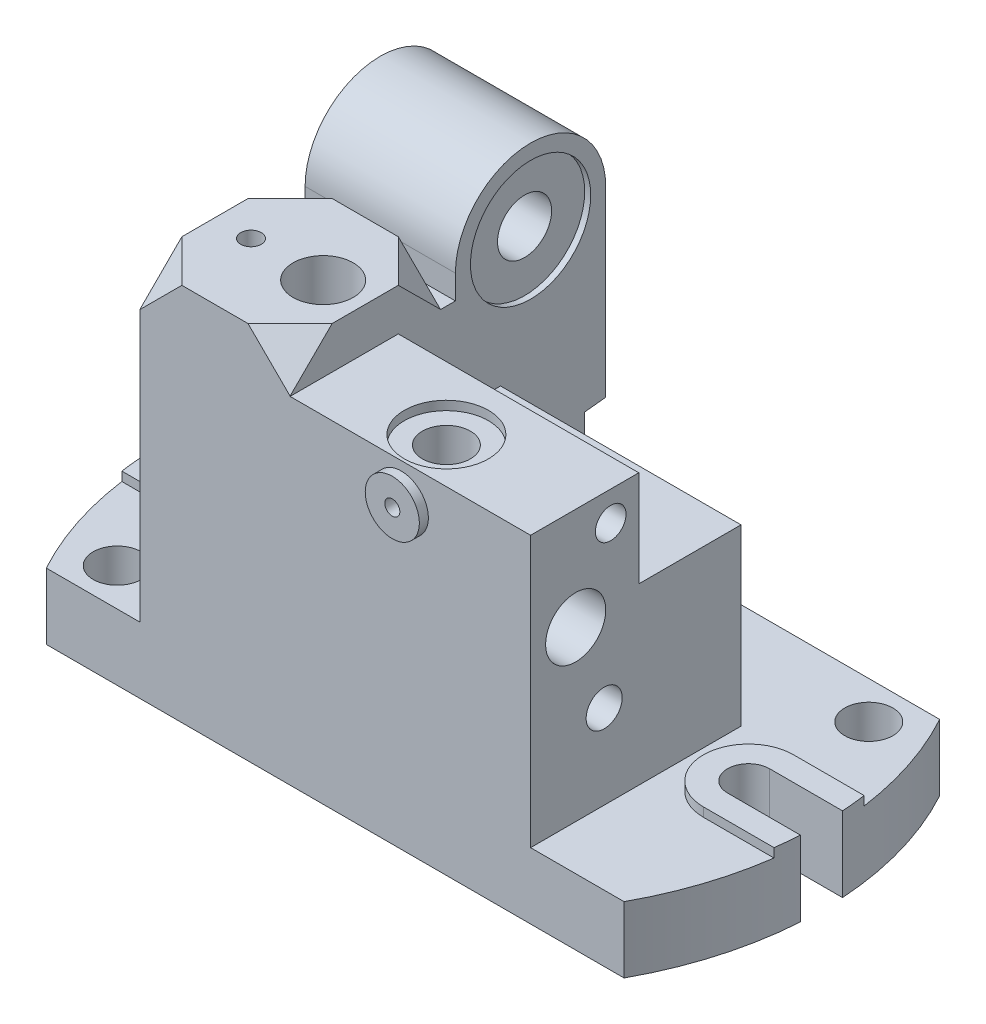
from build123d import *

# Parameters (mm, degrees)
EXTRUDE_1_DEPTH          = 22
SKETCH_2_W               = 130
SKETCH_2_H               = 70
EXTRUDE_2_DEPTH          = 90
CUT_EXTRUDE_2_REACH      = 167.198
SKETCH_4_R               = 8
EXTRUDE_3_DEPTH          = 50
SKETCH_6_W               = 50
SKETCH_6_H               = 50
EXTRUDE_4_DEPTH          = 14
CHAMFER_START            = -142
CHAMFER_1_OUTLINE_W      = 20
CHAMFER_1_OUTLINE_H      = 22
CHAMFER_1_DEPTH          = 9.498113221
CHAMFER_START_2          = 86.62897838
CHAMFER_2_DEPTH          = 9.37102162
CHAMFER_START_3          = -134.90192828
CHAMFER_3_DEPTH          = 45.34578231
CHAMFER_START_4          = 32.785213501
CHAMFER_4_DEPTH          = 35.552289575
SKETCH_8_W               = 80
SKETCH_8_H               = 34
CUT_EXTRUDE_3_DEPTH      = 32
SKETCH_9_R               = 20
CUT_EXTRUDE_4_DEPTH      = 2
SKETCH_10_R              = 9
CUT_EXTRUDE_5_DEPTH      = 48
CUT_EXTRUDE_6_DEPTH      = 50
HOLE_WIZARD_M24_2_D      = 21
HOLE_WIZARD_M24_2_DEPTH  = 17
CHAMFER_5_SIZE           = 1
SKETCH_17_R              = 10
CUT_EXTRUDE_7_DEPTH      = 113
SKETCH_18_R              = 14
CUT_EXTRUDE_8_DEPTH      = 3
CUT_EXTRUDE_9_REACH      = 165.179
CUT_EXTRUDE_9_END_RADIUS = 10
SKETCH_19_R              = 8
EXTRUDE_5_DEPTH          = 25
CUT_EXTRUDE_10_REACH     = 172.723
SKETCH_3_W               = 96
SKETCH_3_H               = 46
CUT_EXTRUDE_1_DEPTH      = 60
SKETCH_22_R              = 12.5
EXTRUDE_6_DEPTH          = 4
HOLE_WIZARD_M8_1_D       = 6.8
HOLE_WIZARD_M8_1_DEPTH   = 20
HOLE_WIZARD_M8_1_TIP     = 2.042926105
SKETCH_24_R              = 9
EXTRUDE_7_DEPTH          = 3
SKETCH_28_R              = 10
CUT_EXTRUDE_11_DEPTH     = 35
HOLE_WIZARD_M6_1_REACH   = 199.224
HOLE_WIZARD_M6_1_BORE_R  = 2.5
CUT_EXTRUDE_12_REACH     = 197.692
SKETCH_39_R              = 6
SKETCH_40_R              = 7
CUT_EXTRUDE_13_DEPTH     = 4
HOLE_WIZARD_M5_1_D       = 4.2
HOLE_WIZARD_M5_1_DEPTH   = 14
HOLE_WIZARD_M5_1_TIP     = 1.2618073
CUT_EXTRUDE_14_REACH     = 235.404
SKETCH_44_R              = 6


with BuildPart() as part:
    # 草图1 → 凸台-拉伸1 (new body)
    with BuildSketch(Plane(origin=(0, 0, 0), x_dir=(1, 0, 0), z_dir=(0, 1, 0))):
        with BuildLine():
            Line((-96.093704268, 52.5), (96.093704268, 52.5))
            ThreePointArc((96.093704268, 52.5), (109.5, 0), (96.093704268, -52.5))
            Line((96.093704268, -52.5), (-96.093704268, -52.5))
            ThreePointArc((-96.093704268, -52.5), (-109.5, 0), (-96.093704268, 52.5))
        make_face()
    extrude(amount=EXTRUDE_1_DEPTH)

    # 草图2 → 凸台-拉伸2 (add)
    with BuildSketch(Plane(origin=(0, 22, 0), x_dir=(1, 0, 0), z_dir=(0, 1, 0))):
        with Locations((0, -17.5)):
            Rectangle(SKETCH_2_W, SKETCH_2_H)
    extrude(amount=EXTRUDE_2_DEPTH)

    # 草图4 → 切除-拉伸2 (cut, up to next)
    with BuildSketch(Plane.XZ, mode=Mode.PRIVATE) as cut_extrude_2_sk1:
        with Locations(Location((85, -40, 0), (0, 0, 270))):
            Circle(SKETCH_4_R)
    cut_extrude_2_tool1 = extrude(cut_extrude_2_sk1.sketch, amount=-CUT_EXTRUDE_2_REACH, mode=Mode.PRIVATE) & part.part
    # 草图4 → 切除-拉伸2 (cut, up to next)
    with BuildSketch(Plane.XZ, mode=Mode.PRIVATE) as cut_extrude_2_sk2:
        with Locations(Location((-85, 40, 0), (0, 0, 270))):
            Circle(SKETCH_4_R)
    cut_extrude_2_tool2 = extrude(cut_extrude_2_sk2.sketch, amount=-CUT_EXTRUDE_2_REACH, mode=Mode.PRIVATE) & part.part
    add(cut_extrude_2_tool1.solids().sort_by_distance((85, 0, -40))[0], mode=Mode.SUBTRACT)
    add(cut_extrude_2_tool2.solids().sort_by_distance((-85, 0, 40))[0], mode=Mode.SUBTRACT)

    # 草图5 → 凸台-拉伸3 (add)
    with BuildSketch(Plane.ZY.offset(65)):
        with BuildLine():
            Line((52.5, 22), (-52.5, 22))
            Line((-52.5, 22), (-52.5, 120))
            ThreePointArc((-52.5, 120), (-27.5, 145), (-2.5, 120))
            Line((-2.5, 120), (-2.5, 112))
            Line((-2.5, 112), (52.5, 112))
            Line((52.5, 112), (52.5, 22))
        make_face()
    extrude(amount=-EXTRUDE_3_DEPTH)

    # 草图6 → 凸台-拉伸4 (add)
    with BuildSketch(Plane(origin=(0, 112, 0), x_dir=(1, 0, 0), z_dir=(0, 1, 0))):
        with Locations((-40, -27.5)):
            Rectangle(SKETCH_6_W, SKETCH_6_H)
    extrude(amount=EXTRUDE_4_DEPTH)

    # 倒角1: read off the stored shape, not the designer's step
    # 倒角1 outline → 倒角1 (cut)
    with BuildSketch(Plane(origin=(0, 0, 0), x_dir=(0.8164965809277258, 0.40824829046386313, 0.40824829046386313), z_dir=(0.5773502691896258, -0.5773502691896258, -0.5773502691896258)).offset(CHAMFER_START)):
        with Locations((23, -52)):
            Rectangle(CHAMFER_1_OUTLINE_W, CHAMFER_1_OUTLINE_H)
    extrude(amount=CHAMFER_1_DEPTH, mode=Mode.SUBTRACT)

    # 倒角2: read off the stored shape, not the designer's step
    # 倒角2 outline → 倒角2 (cut)
    with BuildSketch(Plane(origin=(0, 0, 0), x_dir=(0.8174738237346374, -0.40872641016099387, -0.40580693580270144), z_dir=(0.5759657520275584, 0.5801093905313534, 0.5759657520275585)).offset(CHAMFER_START_2)):
        Polygon((-79.385202065, 41.726128481), (-79.385202065, 61.454534398), (-96.511132698, 51.519621216), align=None)
    extrude(amount=CHAMFER_2_DEPTH, mode=Mode.SUBTRACT)

    # 倒角3: read off the stored shape, not the designer's step
    # 倒角3 outline → 倒角3 (cut)
    with BuildSketch(Plane(origin=(0, 0, 0), x_dir=(0.7045678226077661, 0.7096366558639369, 0), z_dir=(0.7096366558639368, -0.7045678226077663, 0)).offset(CHAMFER_START_3)):
        Polygon((78.8457013, 16.5), (68.981751783, 2.5), (80, 2.5), (80, 18), (79.902553034, 18), align=None)
    extrude(amount=CHAMFER_3_DEPTH, mode=Mode.SUBTRACT)

    # 倒角4: read off the stored shape, not the designer's step
    # 倒角4 outline → 倒角4 (cut)
    with BuildSketch(Plane(origin=(0, 0, 0), x_dir=(0.7045678226077663, -0.7096366558639366, 0), z_dir=(0.7096366558639366, 0.7045678226077662, 0)).offset(CHAMFER_START_4)):
        Polygon((-135.211127108, -16.5), (-125.347177592, -2.5), (-137, -2.5), (-137, -18), (-136.267978842, -18), align=None)
    extrude(amount=CHAMFER_4_DEPTH, mode=Mode.SUBTRACT)

    # 草图8 → 切除-拉伸3 (cut)
    with BuildSketch(Plane(origin=(0, 112, 0), x_dir=(1, 0, 0), z_dir=(0, 1, 0))):
        with Locations((25, 0.5)):
            Rectangle(SKETCH_8_W, SKETCH_8_H)
    extrude(amount=-CUT_EXTRUDE_3_DEPTH, mode=Mode.SUBTRACT)

    # 草图9 → 切除-拉伸4 (cut)
    with BuildSketch(Plane(origin=(-15, 0, 0), x_dir=(0, 0, -1), z_dir=(1, 0, 0))):
        with Locations((27.5, 120)):
            Circle(SKETCH_9_R)
    extrude(amount=-CUT_EXTRUDE_4_DEPTH, mode=Mode.SUBTRACT)

    # 草图10 → 切除-拉伸5 (cut)
    with BuildSketch(Plane(origin=(-17, 0, 0), x_dir=(0, 0, -1), z_dir=(1, 0, 0))):
        with Locations((27.5, 120)):
            Circle(SKETCH_10_R)
    extrude(amount=-CUT_EXTRUDE_5_DEPTH, mode=Mode.SUBTRACT)

    # 草图11 → 切除-拉伸6 (cut)
    with BuildSketch(Plane.ZY.offset(65)):
        Polygon((-52.5, 40.75), (-52.5, 59.25), (-45.5, 58.5), (-45.5, 41.5), align=None)
    extrude(amount=-CUT_EXTRUDE_6_DEPTH, mode=Mode.SUBTRACT)

    # M24 螺纹孔2
    with Locations(Plane.ZY.offset(65)):
        with Locations((37.5, 78)):
            Hole(HOLE_WIZARD_M24_2_D / 2, depth=HOLE_WIZARD_M24_2_DEPTH)

    # 倒角5
    chamfer_5_edges = [part.edges().sort_by_distance(p)[0] for p in [
        (-48, 78, 48),
    ]]
    chamfer(chamfer_5_edges, length=CHAMFER_5_SIZE)

    # 草图17 → 切除-拉伸7 (cut)
    with BuildSketch(Plane.ZY.offset(48)):
        with Locations((37.5, 78)):
            Circle(SKETCH_17_R)
    extrude(amount=-CUT_EXTRUDE_7_DEPTH, mode=Mode.SUBTRACT)

    # 草图18 → 切除-拉伸8 (cut)
    with BuildSketch(Plane(origin=(0, 112, 0), x_dir=(1, 0, 0), z_dir=(0, 1, 0))):
        with Locations(Location((22, -37.5, 0), (0, 0, 270))):
            Circle(SKETCH_18_R)
    extrude(amount=-CUT_EXTRUDE_8_DEPTH, mode=Mode.SUBTRACT)

    # 切除-拉伸9: up to this cylinder (the profile starts outside it)
    cut_extrude_9_end = Plane(origin=(22, 78, 37.5), z_dir=(-1, 0, 0)) * Cylinder(CUT_EXTRUDE_9_END_RADIUS, 351.358, mode=Mode.PRIVATE)
    # 草图19 → 切除-拉伸9 (cut, up to the surface)
    with BuildSketch(Plane(origin=(0, 109, 0), x_dir=(1, 0, 0), z_dir=(0, 1, 0)), mode=Mode.PRIVATE) as cut_extrude_9_sk1:
        with Locations(Location((22, -37.5, 0), (0, 0, 270))):
            Circle(SKETCH_19_R)
    cut_extrude_9_tool1 = extrude(cut_extrude_9_sk1.sketch, amount=-CUT_EXTRUDE_9_REACH, mode=Mode.PRIVATE) - cut_extrude_9_end
    add(cut_extrude_9_tool1.solids().sort_by_distance((22, 109, 37.5))[0], mode=Mode.SUBTRACT)

    # 草图20 → 凸台-拉伸5 (add)
    with BuildSketch(Plane.XZ):
        with BuildLine():
            Line((-85, 15), (-108.467737139, 15))
            ThreePointArc((-108.467737139, 15), (-109.5, 0), (-108.467737139, -15))
            Line((-108.467737139, -15), (-85, -15))
            ThreePointArc((-85, -15), (-70, 0), (-85, 15))
        make_face()
        with BuildLine():
            Line((85, 15), (108.467737139, 15))
            ThreePointArc((108.467737139, 15), (109.5, 0), (108.467737139, -15))
            Line((108.467737139, -15), (85, -15))
            ThreePointArc((85, -15), (70, 0), (85, 15))
        make_face()
    extrude(amount=-EXTRUDE_5_DEPTH)

    # 草图21 → 切除-拉伸10 (cut, up to next)
    with BuildSketch(Plane(origin=(0, 25, 0), x_dir=(1, 0, 0), z_dir=(0, 1, 0)), mode=Mode.PRIVATE) as cut_extrude_10_sk1:
        with BuildLine():
            Line((-85, 7), (-115, 7))
            Line((-115, 7), (-115, -7))
            Line((-115, -7), (-85, -7))
            ThreePointArc((-85, -7), (-78, 0), (-85, 7))
        make_face()
    cut_extrude_10_tool1 = extrude(cut_extrude_10_sk1.sketch, amount=-CUT_EXTRUDE_10_REACH, mode=Mode.PRIVATE) & part.part
    # 草图21 → 切除-拉伸10 (cut, up to next)
    with BuildSketch(Plane(origin=(0, 25, 0), x_dir=(1, 0, 0), z_dir=(0, 1, 0)), mode=Mode.PRIVATE) as cut_extrude_10_sk2:
        with BuildLine():
            Line((115, -7), (85, -7))
            ThreePointArc((85, -7), (78, 0), (85, 7))
            Line((85, 7), (115, 7))
            Line((115, 7), (115, -7))
        make_face()
    cut_extrude_10_tool2 = extrude(cut_extrude_10_sk2.sketch, amount=-CUT_EXTRUDE_10_REACH, mode=Mode.PRIVATE) & part.part
    add(cut_extrude_10_tool1.solids().sort_by_distance((-97.216724, 25, 0))[0], mode=Mode.SUBTRACT)
    add(cut_extrude_10_tool2.solids().sort_by_distance((97.216724, 25, 0))[0], mode=Mode.SUBTRACT)

    # 草图3 → 切除-拉伸1 (cut)
    with BuildSketch(Plane.XZ):
        with Locations((5, 17.5)):
            Rectangle(SKETCH_3_W, SKETCH_3_H)
    extrude(amount=-CUT_EXTRUDE_1_DEPTH, mode=Mode.SUBTRACT)

    # 草图22 → 凸台-拉伸6 (add)
    with BuildSketch(Plane.XZ.offset(-60)):
        with Locations(Location((25, 17.5, 0), (0, 0, 270))):
            Circle(SKETCH_22_R)
    extrude(amount=EXTRUDE_6_DEPTH)

    # M8 螺纹孔1
    with Locations(Plane(origin=(25, 56, 17.5), x_dir=(0, 0, -1), z_dir=(0, -1, 0))):
        with Locations((0, 0)):
            Hole(HOLE_WIZARD_M8_1_D / 2, depth=HOLE_WIZARD_M8_1_DEPTH)
            with Locations((0, 0, -(HOLE_WIZARD_M8_1_DEPTH + HOLE_WIZARD_M8_1_TIP / 2))):  # 118° drill point
                Cone(0, HOLE_WIZARD_M8_1_D / 2, HOLE_WIZARD_M8_1_TIP, mode=Mode.SUBTRACT)

    # 草图24 → 凸台-拉伸7 (add)
    with BuildSketch(Plane.XY.offset(52.5)):
        with Locations(Location((22, 100, 0), (0, 0, 180))):
            Circle(SKETCH_24_R)
    extrude(amount=EXTRUDE_7_DEPTH)

    # M8 螺纹孔2: read off the stored shape, not the designer's step
    # M8 螺纹孔2 outline → M8 螺纹孔2 (revolve, cut)
    with BuildSketch(Plane(origin=(-53, 0, 27.5), x_dir=(1, 0, 0), z_dir=(0, 0, 1))):
        Polygon((0, 126), (0, 104.207073895), (3.4, 106.25), (3.4, 126), align=None)
    revolve(axis=Axis((-53, 0, 27.5), (0, 1, 0)), mode=Mode.SUBTRACT)

    # 草图28 → 切除-拉伸11 (cut)
    with BuildSketch(Plane(origin=(0, 126, 0), x_dir=(1, 0, 0), z_dir=(0, 1, 0))):
        with Locations(Location((-29, -27.5, 0), (0, 0, 270))):
            Circle(SKETCH_28_R)
    extrude(amount=-CUT_EXTRUDE_11_DEPTH, mode=Mode.SUBTRACT)

    # M12 螺纹孔1: read off the stored shape, not the designer's step
    # M12 螺纹孔1 outline → M12 螺纹孔1 (revolve, cut)
    with BuildSketch(Plane(origin=(0, 102.19971589, 25.849651596), x_dir=(0, 1, 0), z_dir=(0, 0, -1))):
        Polygon((0, 65), (0, 31.935610843), (5.1, 35), (5.1, 65), align=None)
    revolve(axis=Axis((0, 102.19971589, 25.849651596), (1, 0, 0)), mode=Mode.SUBTRACT)

    # M6 螺纹孔1 bore (on position points) → M6 螺纹孔1 (cut, up to next)
    with BuildSketch(Plane(origin=(22, 100, 55.5), x_dir=(1, 0, 0), z_dir=(0, 0, 1)), mode=Mode.PRIVATE) as hole_wizard_m6_1_sk1:
        Circle(HOLE_WIZARD_M6_1_BORE_R)
    hole_wizard_m6_1_tool1 = extrude(hole_wizard_m6_1_sk1.sketch, amount=-HOLE_WIZARD_M6_1_REACH, mode=Mode.PRIVATE) & part.part
    add(hole_wizard_m6_1_tool1.solids().sort_by_distance((22, 100, 55.5))[0], mode=Mode.SUBTRACT)

    # M8 螺纹孔4: read off the stored shape, not the designer's step
    # M8 螺纹孔4 outline → M8 螺纹孔4 (revolve, cut)
    with BuildSketch(Plane(origin=(-53, 50, 0), x_dir=(1, 0, 0), z_dir=(0, -1, 0))):
        Polygon((3.4, -25.5), (0, -23.457073895), (0, -45.5), (3.4, -45.5), align=None)
    revolve(axis=Axis((-53, 50, 0), (0, 0, 1)), mode=Mode.SUBTRACT)

    # Hole Wizard M8 _4 2 outline → Hole Wizard M8 _4 2 (revolve, cut)
    with BuildSketch(Plane(origin=(-27, 50, 0), x_dir=(1, 0, 0), z_dir=(0, -1, 0))):
        Polygon((3.4, -25.5), (0, -23.457073895), (0, -45.5), (3.4, -45.5), align=None)
    revolve(axis=Axis((-27, 50, 0), (0, 0, 1)), mode=Mode.SUBTRACT)

    # 草图39 → 切除-拉伸12 (cut, up to next)
    with BuildSketch(Plane(origin=(0, 0, -17.5), x_dir=(-1, 0, 0), z_dir=(0, 0, -1)), mode=Mode.PRIVATE) as cut_extrude_12_sk1:
        with Locations((0, 50)):
            Circle(SKETCH_39_R)
    cut_extrude_12_tool1 = extrude(cut_extrude_12_sk1.sketch, amount=-CUT_EXTRUDE_12_REACH, mode=Mode.PRIVATE) & part.part
    add(cut_extrude_12_tool1.solids().sort_by_distance((0, 50, -17.5))[0], mode=Mode.SUBTRACT)

    # 草图40 → 切除-拉伸13 (cut)
    with BuildSketch(Plane.XZ):
        with Locations(Location((-55, 0, 0), (0, 0, 270))):
            Circle(SKETCH_40_R)
        with Locations(Location((65, 0, 0), (0, 0, 90))):
            Circle(SKETCH_40_R)
    extrude(amount=-CUT_EXTRUDE_13_DEPTH, mode=Mode.SUBTRACT)

    # M5 螺纹孔1
    with Locations(Plane(origin=(-55, 4, 0), x_dir=(0, 0, -1), z_dir=(0, -1, 0))):
        with Locations((0, 0), (0, 120)):
            Hole(HOLE_WIZARD_M5_1_D / 2, depth=HOLE_WIZARD_M5_1_DEPTH)
            with Locations((0, 0, -(HOLE_WIZARD_M5_1_DEPTH + HOLE_WIZARD_M5_1_TIP / 2))):  # 118° drill point
                Cone(0, HOLE_WIZARD_M5_1_D / 2, HOLE_WIZARD_M5_1_TIP, mode=Mode.SUBTRACT)

    # 草图44 → 切除-拉伸14 (cut, up to next)
    with BuildSketch(Plane(origin=(65, 0, 0), x_dir=(0, 0, -1), z_dir=(1, 0, 0)), mode=Mode.PRIVATE) as cut_extrude_14_sk1:
        with Locations((-28.017319601, 50)):
            Circle(SKETCH_44_R)
    cut_extrude_14_tool1 = extrude(cut_extrude_14_sk1.sketch, amount=-CUT_EXTRUDE_14_REACH, mode=Mode.PRIVATE) & part.part
    add(cut_extrude_14_tool1.solids().sort_by_distance((65, 50, 28.01732))[0], mode=Mode.SUBTRACT)


solid = part.part
